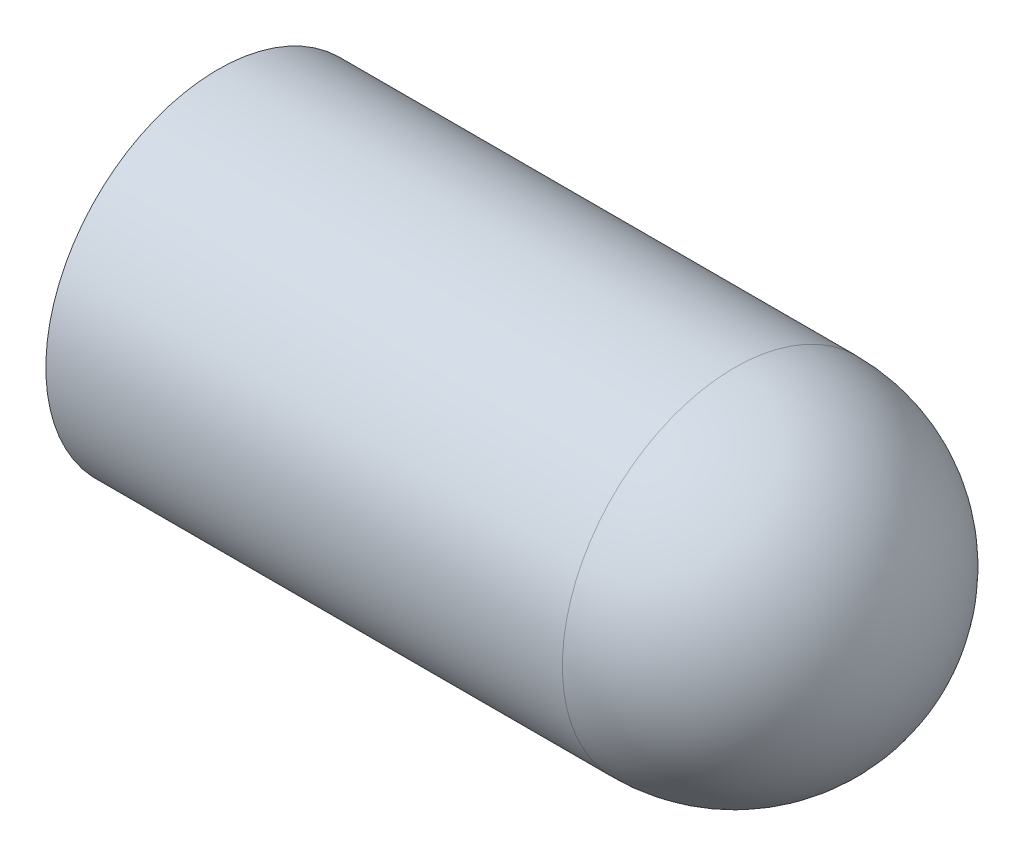
from build123d import *

# Parameters (mm, degrees)
SKETCH1_R           = 5
BOSS_EXTRUDE1_DEPTH = 7.5
DOME1_FACE_RADIUS   = 5
DOME1_HEIGHT        = 5


# Read off the part's stored shape, not the designer's step: Shell1
with BuildPart() as part:
    # Sketch1 → Boss-Extrude1 (new, symmetric)
    with BuildSketch(Plane(origin=(0, 0, 0), x_dir=(0, 0, -1), z_dir=(1, 0, 0))):
        Circle(SKETCH1_R)
    extrude(amount=BOSS_EXTRUDE1_DEPTH, both=True)

    # Dome1: a dome of height H over a round flat face of radius A is a cap of a sphere of radius (A * A + H * H) / (2 * H)
    dome1_r = (DOME1_FACE_RADIUS * DOME1_FACE_RADIUS + DOME1_HEIGHT * DOME1_HEIGHT) / (2 * DOME1_HEIGHT)
    dome1_base = Plane((7.5, 0, 0), z_dir=(1, 0, 0))
    with Locations(dome1_base.offset(DOME1_HEIGHT - dome1_r)):
        dome1_ball = Sphere(dome1_r, mode=Mode.PRIVATE)
    add(split(dome1_ball, bisect_by=dome1_base, keep=Keep.TOP, mode=Mode.PRIVATE))

    # Shell1 outline → Shell1 (revolve, cut)
    with BuildSketch(Plane.YX):
        with BuildLine():
            Line((4, -7.5), (4, 7.499999996))
            ThreePointArc((4, 7.499999996), (2.828427126, 10.328427123), (0, 11.5))
            Line((0, 11.5), (0, -7.5))
            Line((0, -7.5), (4, -7.5))
        make_face()
    revolve(axis=Axis((0, 0, 0), (1, 0, 0)), mode=Mode.SUBTRACT)


solid = part.part
